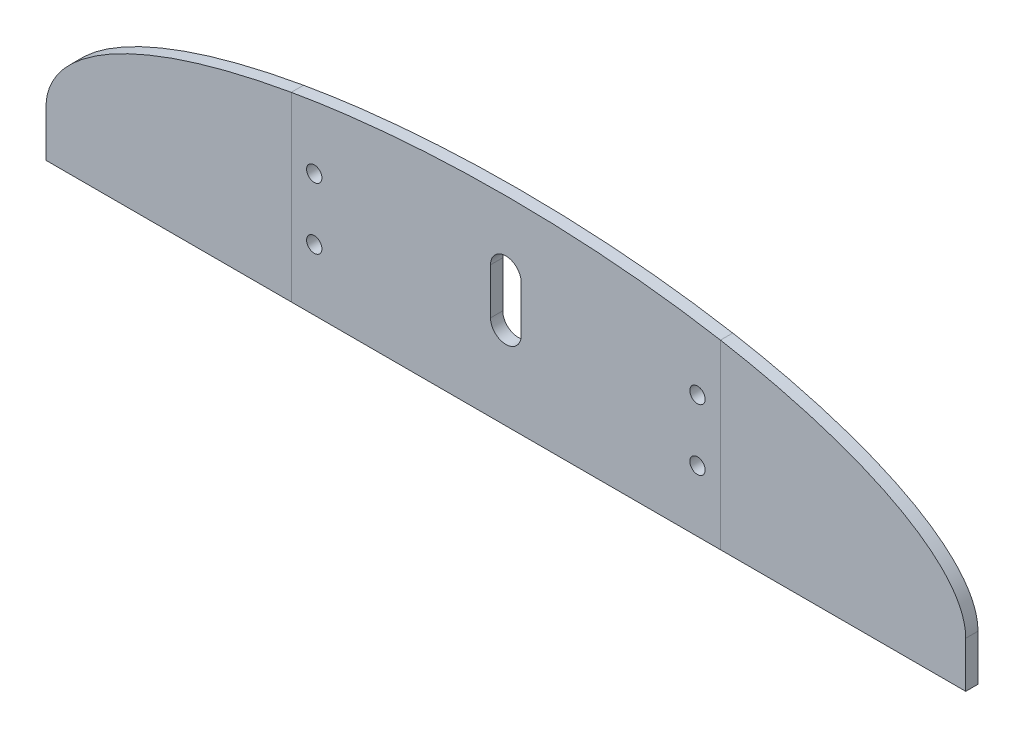
from build123d import *

# Parameters (mm, degrees)
ESQUISSE1_RX                   = 150
ESQUISSE1_RY                   = 50
BOSS_EXTRU_2_DEPTH             = 4
ESQUISSE2_W                    = 328.393114187
ESQUISSE2_H                    = 54.583456932
ENL_V_MAT_EXTRU_1_DEPTH        = 4
ENL_V_MAT_EXTRU_2_DEPTH        = 4
ESQUISSE5_W                    = 300
ESQUISSE5_H                    = 4
BOSS_EXTRU_3_DEPTH             = 15
ESQUISSE8_W                    = 20
ESQUISSE8_H                    = 12.480168935
BOSS_EXTRU_5_DEPTH             = 10
ESQUISSE9_R                    = 2.5
ENL_V_MAT_EXTRU_4_DEPTH        = 12.480168935
CHANFREIN1_SIZE                = 3
R_P_TITION_START               = -15
R_P_TITION_LIN_AIRE2_OUTLINE_R = 2.5
R_P_TITION_LIN_AIRE2_DEPTH     = 12.480168935
R_P_TITION_LIN_AIRE3_OUTLINE_R = 2.5
R_P_TITION_LIN_AIRE3_DEPTH     = 12.480168935
ESQUISSE15_W                   = 30
ESQUISSE15_H                   = 40
BOSS_EXTRU_7_DEPTH             = 5
BOSS_EXTRU_7_2_DEPTH           = 5
ENL_V_START                    = -9
ESQUISSE16_R                   = 2.5
ENL_V_MAT_EXTRU_7_DEPTH        = 9
FRACTIONNER2_START             = -150
FRACTIONNER2_DEPTH             = 80
FRACTIONNER2_START_2           = 70
FRACTIONNER2_2_DEPTH           = 80
FRACTIONNER2_START_3           = -15
FRACTIONNER2_3_OUTLINE_R       = 2.5
FRACTIONNER2_3_DEPTH           = 12.480168935
FRACTIONNER2_START_4           = -2.519831065
FRACTIONNER2_4_OUTLINE_W       = 80
FRACTIONNER2_4_OUTLINE_H       = 4
FRACTIONNER2_4_DEPTH           = 2.519831065
FRACTIONNER2_5_DEPTH           = 4
FRACTIONNER2_6_OUTLINE_R       = 2.5
FRACTIONNER2_6_DEPTH           = 12.480168935
FRACTIONNER2_7_OUTLINE_W       = 80
FRACTIONNER2_7_OUTLINE_H       = 4
FRACTIONNER2_7_DEPTH           = 2.519831065
FRACTIONNER2_8_DEPTH           = 4


with BuildPart() as part:
    # Esquisse1 → Boss.-Extru.2 (new body)
    with BuildSketch(Plane.XY):
        with Locations((0, 0)):
            Ellipse(ESQUISSE1_RX, ESQUISSE1_RY)
    extrude(amount=BOSS_EXTRU_2_DEPTH)

    # Esquisse2 → Enlèv. mat.-Extru.1 (cut)
    with BuildSketch(Plane.XY.offset(4)):
        with Locations((5.354235558, -27.291728466)):
            Rectangle(ESQUISSE2_W, ESQUISSE2_H)
    extrude(amount=-ENL_V_MAT_EXTRU_1_DEPTH, mode=Mode.SUBTRACT)

    # Esquisse3 → Enlèv. mat.-Extru.2 (cut)
    with BuildSketch(Plane.XY.offset(4)):
        with BuildLine():
            Line((5, 28), (5, 13))
            ThreePointArc((5, 13), (0, 8), (-5, 13))
            Line((-5, 13), (-5, 28))
            ThreePointArc((-5, 28), (0, 33), (5, 28))
        make_face()
    extrude(amount=-ENL_V_MAT_EXTRU_2_DEPTH, mode=Mode.SUBTRACT)

    # Esquisse5 → Boss.-Extru.3 (add)
    with BuildSketch(Plane.XZ):
        with Locations((0, 2)):
            Rectangle(ESQUISSE5_W, ESQUISSE5_H)
    extrude(amount=BOSS_EXTRU_3_DEPTH)

    # Esquisse8 → Boss.-Extru.5 (add)
    with BuildSketch(Plane(origin=(0, 0, 0), x_dir=(-1, 0, 0), z_dir=(0, 0, -1))):
        with Locations((-125, -8.759915533)):
            Rectangle(ESQUISSE8_W, ESQUISSE8_H)
    extrude(amount=BOSS_EXTRU_5_DEPTH)

    # Esquisse9 → Enlèv. mat.-Extru.4 (cut)
    with BuildSketch(Plane(origin=(0, -2.519831065, 0), x_dir=(1, 0, 0), z_dir=(0, 1, 0))):
        with Locations(Location((125, 5, 0), (0, 0, 270))):
            Circle(ESQUISSE9_R)
    extrude(amount=-ENL_V_MAT_EXTRU_4_DEPTH, mode=Mode.SUBTRACT)

    # Chanfrein1
    chanfrein1_edges = [part.edges().sort_by_distance(p)[0] for p in [
        (135, -8.759915532, 0),
        (115, -8.759915532, 0),
    ]]
    chamfer(chanfrein1_edges, length=CHANFREIN1_SIZE)

    # Répétition linéaire2: read off the stored shape, not the designer's step
    # Répétition linéaire2 outline → Répétition linéaire2 (add)
    with BuildSketch(Plane(origin=(0, 0, 0), x_dir=(1, 0, 0), z_dir=(0, 1, 0)).offset(R_P_TITION_START)):
        Polygon((110, 10), (90, 10), (90, 3), (87, 0), (112, 0), (112.5, 0.5), (110, 3), align=None)
        with Locations((100, 5)):
            Circle(R_P_TITION_LIN_AIRE2_OUTLINE_R, mode=Mode.SUBTRACT)
    extrude(amount=R_P_TITION_LIN_AIRE2_DEPTH)

    # Répétition linéaire3: read off the stored shape, not the designer's step
    # Répétition linéaire3 outline → Répétition linéaire3 (add)
    with BuildSketch(Plane(origin=(0, 0, 0), x_dir=(1, 0, 0), z_dir=(0, 1, 0)).offset(R_P_TITION_START)):
        Polygon((-90, 10), (-110, 10), (-110, 3), (-112.5, 0.5), (-115, 3), (-115, 10), (-135, 10), (-135, 3), (-138, 0), (-87, 0), (-90, 3), align=None)
        with Locations((-125, 5)):
            Circle(R_P_TITION_LIN_AIRE3_OUTLINE_R, mode=Mode.SUBTRACT)
        with Locations((-100, 5)):
            Circle(R_P_TITION_LIN_AIRE3_OUTLINE_R, mode=Mode.SUBTRACT)
    extrude(amount=R_P_TITION_LIN_AIRE3_DEPTH)


with BuildPart() as body_2:
    # Esquisse15 → Boss.-Extru.7 (new body)
    with BuildSketch(Plane(origin=(0, 0, 0), x_dir=(-1, 0, 0), z_dir=(0, 0, -1))):
        with Locations((-70, 15)):
            Rectangle(ESQUISSE15_W, ESQUISSE15_H)
    extrude(amount=BOSS_EXTRU_7_DEPTH)


with BuildPart() as body_3:
    # Esquisse15 → Boss.-Extru.7 2 (new body)
    with BuildSketch(Plane(origin=(0, 0, 0), x_dir=(-1, 0, 0), z_dir=(0, 0, -1))):
        with Locations((70, 15)):
            Rectangle(ESQUISSE15_W, ESQUISSE15_H)
    extrude(amount=BOSS_EXTRU_7_2_DEPTH)


with BuildPart() as enl_v_mat_extru_7_tool:
    # Esquisse16 → Enlèv. mat.-Extru.7 (new body)
    with BuildSketch(Plane(origin=(0, 0, -5), x_dir=(-1, 0, 0), z_dir=(0, 0, -1)).offset(ENL_V_START)):
        with Locations((-62.5, 25)):
            Circle(ESQUISSE16_R)
        with Locations((62.5, 25)):
            Circle(ESQUISSE16_R)
        with Locations((-62.5, 5)):
            Circle(ESQUISSE16_R)
        with Locations((62.5, 5)):
            Circle(ESQUISSE16_R)
    extrude(amount=ENL_V_MAT_EXTRU_7_DEPTH)


with BuildPart() as part_1:
    add(part.part)

    # Enlèv. mat.-Extru.7: cut by enl_v_mat_extru_7_tool
    add(enl_v_mat_extru_7_tool.part, mode=Mode.SUBTRACT)

    # Fractionner2: read off the stored shape, not the designer's step
    # Fractionner2 outline → Fractionner2 (cut)
    with BuildSketch(Plane.YZ.offset(FRACTIONNER2_START)):
        Polygon((-2.519831065, -10), (-2.519831065, 0), (46, 0), (46, 4), (-15, 4), (-15, -10), align=None)
    extrude(amount=FRACTIONNER2_DEPTH, mode=Mode.SUBTRACT)

    # Fractionner2 2 outline → Fractionner2 2 (cut)
    with BuildSketch(Plane.YZ.offset(FRACTIONNER2_START_2)):
        Polygon((-2.519831065, -10), (-2.519831065, 0), (46, 0), (46, 4), (-15, 4), (-15, -10), align=None)
    extrude(amount=FRACTIONNER2_2_DEPTH, mode=Mode.SUBTRACT)


with BuildPart() as body_2_1:
    add(body_2.part)

    # Enlèv. mat.-Extru.7: cut by enl_v_mat_extru_7_tool
    add(enl_v_mat_extru_7_tool.part, mode=Mode.SUBTRACT)


with BuildPart() as body_3_1:
    add(body_3.part)

    # Enlèv. mat.-Extru.7: cut by enl_v_mat_extru_7_tool
    add(enl_v_mat_extru_7_tool.part, mode=Mode.SUBTRACT)


with BuildPart() as body_4:
    # Fractionner2 3 outline → Fractionner2 3 (new body)
    with BuildSketch(Plane(origin=(0, 0, 0), x_dir=(1, 0, 0), z_dir=(0, 1, 0)).offset(FRACTIONNER2_START_3)):
        Polygon((-70, -4), (-70, 0), (-87, 0), (-90, 3), (-90, 10), (-110, 10), (-110, 3), (-112.5, 0.5), (-115, 3), (-115, 10), (-135, 10), (-135, 3), (-138, 0), (-150, 0), (-150, -4), align=None)
        with Locations((-100, 5)):
            Circle(FRACTIONNER2_3_OUTLINE_R, mode=Mode.SUBTRACT)
        with Locations((-125, 5)):
            Circle(FRACTIONNER2_3_OUTLINE_R, mode=Mode.SUBTRACT)
    extrude(amount=FRACTIONNER2_3_DEPTH)

    # Fractionner2 4 outline → Fractionner2 4 (add)
    with BuildSketch(Plane(origin=(0, 0, 0), x_dir=(1, 0, 0), z_dir=(0, 1, 0)).offset(FRACTIONNER2_START_4)):
        with Locations((-110, -2)):
            Rectangle(FRACTIONNER2_4_OUTLINE_W, FRACTIONNER2_4_OUTLINE_H)
    extrude(amount=FRACTIONNER2_4_DEPTH)

    # Fractionner2 5 outline → Fractionner2 5 (add)
    with BuildSketch(Plane.XY):
        with BuildLine():
            Line((-70, 0), (-70, 44.221663871))
            add(Edge.make_bspline(
                [(-70, 44.221663871), (-150, 30.151134458), (-150, 0)],
                knots=[2.056314449, 2.056314449, 2.056314449, 3.141592654, 3.141592654, 3.141592654], degree=2, weights=[1, 0.856348839, 1]))
            Line((-150, 0), (-70, 0))
        make_face()
    extrude(amount=FRACTIONNER2_5_DEPTH)

    # Fractionner3: read off the stored shape, not the designer's step
    # Fractionner3: union body 3
    add(body_3_1.part)


with BuildPart() as body_5:
    # Fractionner2 6 outline → Fractionner2 6 (new body)
    with BuildSketch(Plane(origin=(0, 0, 0), x_dir=(1, 0, 0), z_dir=(0, 1, 0)).offset(FRACTIONNER2_START_3)):
        Polygon((87, 0), (70, 0), (70, -4), (150, -4), (150, 0), (138, 0), (135, 3), (135, 10), (115, 10), (115, 3), (112.5, 0.5), (110, 3), (110, 10), (90, 10), (90, 3), align=None)
        with Locations((125, 5)):
            Circle(FRACTIONNER2_6_OUTLINE_R, mode=Mode.SUBTRACT)
        with Locations((100, 5)):
            Circle(FRACTIONNER2_6_OUTLINE_R, mode=Mode.SUBTRACT)
    extrude(amount=FRACTIONNER2_6_DEPTH)

    # Fractionner2 7 outline → Fractionner2 7 (add)
    with BuildSketch(Plane(origin=(0, 0, 0), x_dir=(1, 0, 0), z_dir=(0, 1, 0)).offset(FRACTIONNER2_START_4)):
        with Locations((110, -2)):
            Rectangle(FRACTIONNER2_7_OUTLINE_W, FRACTIONNER2_7_OUTLINE_H)
    extrude(amount=FRACTIONNER2_7_DEPTH)

    # Fractionner2 8 outline → Fractionner2 8 (add)
    with BuildSketch(Plane.XY):
        with BuildLine():
            Line((70, 0), (150, 0))
            add(Edge.make_bspline(
                [(150, 0), (150, 30.151134458), (70, 44.221663871)],
                knots=[0, 0, 0, 1.085278204, 1.085278204, 1.085278204], degree=2, weights=[1, 0.856348839, 1]))
            Line((70, 44.221663871), (70, 0))
        make_face()
    extrude(amount=FRACTIONNER2_8_DEPTH)


with BuildPart() as body_2_2:
    add(body_2_1.part)

    # Combiner3: union body 5
    add(body_5.part)


solid = Compound([part_1.part, body_4.part, body_2_2.part])
